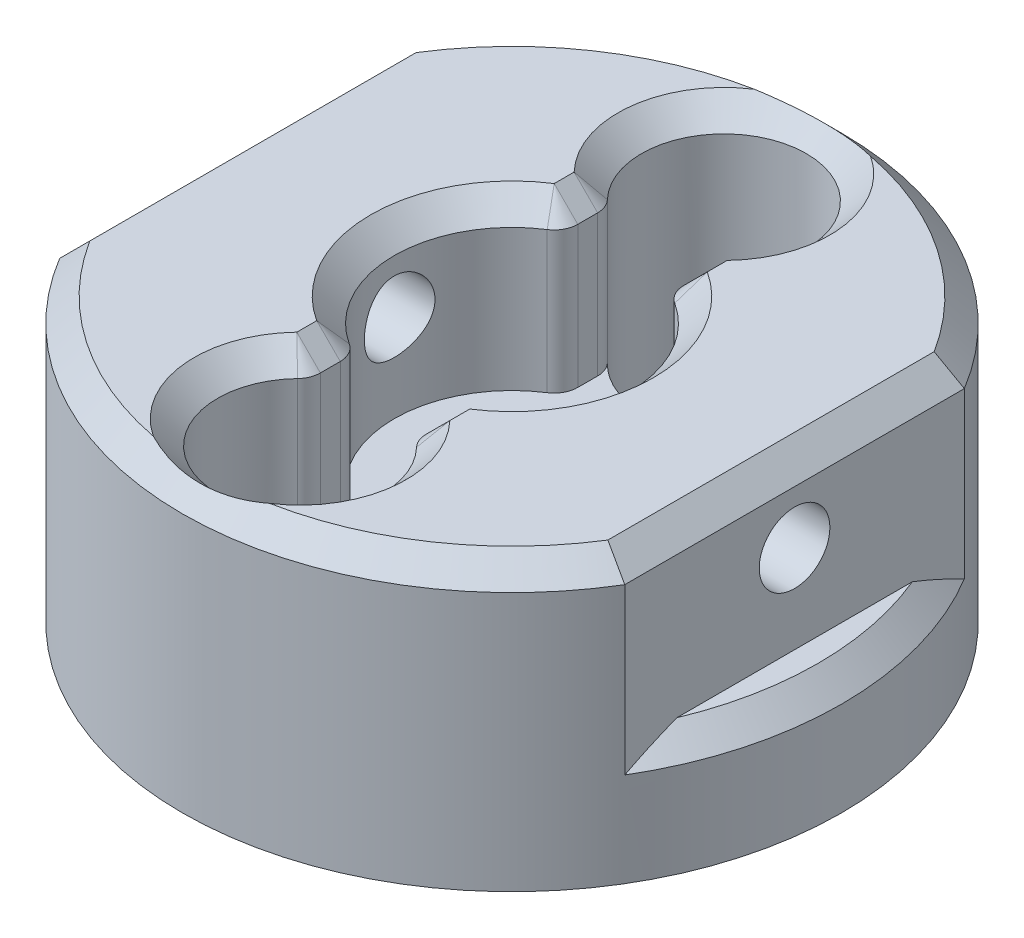
from build123d import *
from build123d.topology import SkipClean

# Parameters (mm, degrees)
SKETCH1_R           = 14
SKETCH1_R_2         = 2.25
BOSS_EXTRUDE1_DEPTH = 5
SKETCH2_R           = 1.5
CUT_EXTRUDE1_DEPTH  = 21.420577857
SKETCH4_R           = 3.5
CUT_EXTRUDE2_DEPTH  = 3
CIRPATTERN1_COUNT   = 2
SKETCH5_R           = 14
SKETCH5_R_2         = 5
BOSS_EXTRUDE2_DEPTH = 7
SKETCH6_R           = 3.5
CUT_EXTRUDE3_DEPTH  = 22
SKETCH9_OUTSIDE_W   = 38.276
SKETCH9_OUTSIDE_H   = 38.276
SKETCH9_OUTSIDE_W_2 = 24
SKETCH9_OUTSIDE_H_2 = 30
CUT_EXTRUDE5_DEPTH  = 7
SKETCH10_R          = 1.5
CUT_EXTRUDE6_DEPTH  = 32.874754901
SKETCH12_W          = 4.5
SKETCH12_H          = 18
CUT_EXTRUDE7_DEPTH  = 7
CHAMFER2_SIZE       = 0.4
CHAMFER2_SIZE2      = 4.572020921
FILLET2_R           = 1
CHAMFER3_SIZE       = 1


# Some blends are built 0.0001 mm under size
with BuildPart() as part:
    # Sketch1 → Boss-Extrude1 (new body)
    with BuildSketch(Plane(origin=(0, 0, 0), x_dir=(1, 0, 0), z_dir=(0, 1, 0))):
        with Locations(Location((0, 0, 0), (0, 0, 270))):
            Circle(SKETCH1_R)
        with Locations(Location((0, 0, 0), (0, 0, 270))):
            Circle(SKETCH1_R_2, mode=Mode.SUBTRACT)
    extrude(amount=BOSS_EXTRUDE1_DEPTH)

    # Sketch2 → Cut-Extrude1 (cut, through all)
    with BuildSketch(Plane(origin=(0, 5, 0), x_dir=(1, 0, 0), z_dir=(0, 1, 0))):
        with Locations(Location((0, 9, 0), (0, 0, 270))):
            Circle(SKETCH2_R)
    cut_extrude1 = extrude(amount=-CUT_EXTRUDE1_DEPTH, mode=Mode.SUBTRACT)

    # Sketch4 → Cut-Extrude2 (cut)
    with BuildSketch(Plane(origin=(0, 5, 0), x_dir=(1, 0, 0), z_dir=(0, 1, 0))):
        with Locations(Location((0, 9, 0), (0, 0, 270))):
            Circle(SKETCH4_R)
    cut_extrude2 = extrude(amount=-CUT_EXTRUDE2_DEPTH, mode=Mode.SUBTRACT)

    # CirPattern1: Cut-Extrude1, Cut-Extrude2 ×2 about axis
    cirpattern1_axis = Axis((0, 0, 0), (0, 1, 0))
    add([cut_extrude1.rotate(cirpattern1_axis, i * 360 / CIRPATTERN1_COUNT) for i in range(1, CIRPATTERN1_COUNT)], mode=Mode.SUBTRACT)
    add([cut_extrude2.rotate(cirpattern1_axis, i * 360 / CIRPATTERN1_COUNT) for i in range(1, CIRPATTERN1_COUNT)], mode=Mode.SUBTRACT)

    # Sketch5 → Boss-Extrude2 (add)
    with BuildSketch(Plane(origin=(0, 5, 0), x_dir=(1, 0, 0), z_dir=(0, 1, 0))):
        with Locations(Location((0, 0, 0), (0, 0, 270))):
            Circle(SKETCH5_R)
        with Locations(Location((0, 0, 0), (0, 0, 270))):
            Circle(SKETCH5_R_2, mode=Mode.SUBTRACT)
    extrude(amount=BOSS_EXTRUDE2_DEPTH)

    # Sketch6 → Cut-Extrude3 (cut, through all)
    with SkipClean():  # the faces are left unmerged after this step: merging them gives an invalid solid
        with BuildSketch(Plane(origin=(0, 5, 0), x_dir=(1, 0, 0), z_dir=(0, 1, 0))):
            with Locations(Location((0, 9, 0), (0, 0, 270))):
                Circle(SKETCH6_R)
            with Locations(Location((0, -9, 0), (0, 0, 270))):
                Circle(SKETCH6_R)
        extrude(amount=CUT_EXTRUDE3_DEPTH, mode=Mode.SUBTRACT)

    # Sketch9 outside → Cut-Extrude5 (cut)
    with SkipClean():  # the faces are left unmerged after this step: merging them gives an invalid solid
        with BuildSketch(Plane(origin=(0, 12, 0), x_dir=(1, 0, 0), z_dir=(0, 1, 0))):
            Rectangle(SKETCH9_OUTSIDE_W, SKETCH9_OUTSIDE_H)
            Rectangle(SKETCH9_OUTSIDE_W_2, SKETCH9_OUTSIDE_H_2, mode=Mode.SUBTRACT)
        extrude(amount=-CUT_EXTRUDE5_DEPTH, mode=Mode.SUBTRACT)

    # Sketch10 → Cut-Extrude6 (cut, through all)
    with SkipClean():  # the faces are left unmerged after this step: merging them gives an invalid solid
        with BuildSketch(Plane(origin=(12, 0, 0), x_dir=(0, 0, -1), z_dir=(1, 0, 0))):
            with Locations((0, 8.75)):
                Circle(SKETCH10_R)
        extrude(amount=-CUT_EXTRUDE6_DEPTH, mode=Mode.SUBTRACT)

    # Sketch12 → Cut-Extrude7 (cut)
    with SkipClean():  # the faces are left unmerged after this step: merging them gives an invalid solid
        with BuildSketch(Plane(origin=(0, 12, 0), x_dir=(1, 0, 0), z_dir=(0, 1, 0))):
            Rectangle(SKETCH12_W, SKETCH12_H)
        extrude(amount=-CUT_EXTRUDE7_DEPTH, mode=Mode.SUBTRACT)
    add(part.part.scale(1), mode=Mode.REPLACE)  # the faces are merged on a copy

    # Chamfer2
    chamfer2_edges = [part.edges().sort_by_distance(p)[0] for p in [
        (1.59099026, 5, 1.590990255),
    ]]
    chamfer2_side = [part.faces().sort_by_distance(p)[0] for p in [
        (0, 5, 3.259288519),
    ]]
    chamfer(chamfer2_edges, length=CHAMFER2_SIZE, length2=CHAMFER2_SIZE2, reference=chamfer2_side[0])

    # Fillet2
    # the kernel refuses this fillet: 1 mm, written as the material it takes off along each edge
    with BuildSketch(Plane(origin=(2.25, 13.446043689, -4.465142775), x_dir=(0, 0, -1), z_dir=(0, -1, 0)), Plane(origin=(-2.25, 13.446043689, 4.465142775), x_dir=(0, 0, 1), z_dir=(0, -1, 0))) as fillet2_piece_1:
        with BuildLine():
            CenterArc((0.578417476, 1), FILLET2_R, 212.797168296, 57.202831704)
            ThreePointArc((-0.262175899, 0.458333333), (-0.125033492, 0.232629939), (0, 0))
            Line((0, 0), (0.578417476, 0))
        make_face()
    extrude(amount=8.446043689, mode=Mode.SUBTRACT)
    with BuildSketch(Plane(origin=(2.25, 13.446043689, 4.465142775), x_dir=(0.8680218565985627, 0, -0.49652598770576395), z_dir=(0, -1, 0))) as fillet2_piece_2:
        with BuildLine():
            CenterArc((0.580822548, 0.998604999), FILLET2_R, 209.770426123, 57.202831704)
            Line((-0.287199308, 0.502079011), (0, 0))
            ThreePointArc((0, 0), (0.264010249, 0.006975006), (0.528020498, 0))
        make_face()
    extrude(amount=8.446043689, mode=Mode.SUBTRACT)
    with BuildSketch(Plane(origin=(-2.25, 13.446043689, -4.465142775), x_dir=(0, 0, -1), z_dir=(0, -1, 0))) as fillet2_piece_3:
        with BuildLine():
            CenterArc((0.578417476, -1), FILLET2_R, 90, 57.202831704)
            ThreePointArc((-0.262175899, -0.458333333), (-0.125033492, -0.232629939), (0, 0))
            Line((0, 0), (0.578417476, 0))
        make_face()
    extrude(amount=8.446043689, mode=Mode.SUBTRACT)
    with BuildSketch(Plane(origin=(-2.25, 13.07880894, -6.319048676), x_dir=(0, 0, 1), z_dir=(0, -1, 0))) as fillet2_piece_4:
        with BuildLine():
            CenterArc((0.431523576, 1), FILLET2_R, 226.238257307, 43.761742693)
            ThreePointArc((-0.260137513, 0.277777778), (-0.126290486, 0.14242722), (0, 0))
            Line((0, 0), (0.431523576, 0))
        make_face()
    extrude(amount=8.07880894, mode=Mode.SUBTRACT)
    with BuildSketch(Plane(origin=(-2.25, 13.07880894, 6.319048676), x_dir=(-0.7299030964550425, 0, 0.683550634397585), z_dir=(0, -1, 0)), Plane(origin=(2.25, 13.07880894, -6.319048676), x_dir=(0.7299030964550413, 0, -0.6835506343975865), z_dir=(0, -1, 0))) as fillet2_piece_5:
        with BuildLine():
            CenterArc((0.434934882, 0.998521029), FILLET2_R, 223.121729096, 43.761742693)
            Line((-0.294968214, 0.314970394), (0, 0))
            ThreePointArc((0, 0), (0.190284011, 0.0051764), (0.380568022, 0))
        make_face()
    extrude(amount=8.07880894, mode=Mode.SUBTRACT)
    with BuildSketch(Plane(origin=(2.25, 13.07880894, 6.319048676), x_dir=(0.7299030964550418, 0, 0.6835506343975857), z_dir=(0, -1, 0))) as fillet2_piece_6:
        with BuildLine():
            CenterArc((0.434934882, -0.998521029), FILLET2_R, 93.116528211, 43.761742693)
            Line((-0.294968214, -0.314970394), (0, 0))
            ThreePointArc((0, 0), (0.190284011, -0.0051764), (0.380568022, 0))
        make_face()
    extrude(amount=8.07880894, mode=Mode.SUBTRACT)

    # Chamfer3
    chamfer3_edges = [part.edges().sort_by_distance(p)[0] for p in [
        (-2.372028854, 12, -4.564846697),
        (5, 12, 0),
        (2.372028854, 12, -4.564846697),
        (2.25, 12, -5.465542675),
        (2.322039273, 12, -6.260203097),
        (0, 12, -12.5),
        (-2.322039273, 12, -6.260203097),
        (-2.25, 12, -5.465542675),
        (-5, 12, 0),
        (-2.372028854, 12, 4.564846697),
        (-2.25, 12, 5.465542675),
        (-2.322039273, 12, 6.260203097),
        (-3.218916614, 12, 10.374254646),
        (3.218916614, 12, 10.374254646),
        (2.322039273, 12, 6.260203097),
        (2.25, 12, 5.465542675),
        (2.372028854, 12, 4.564846697),
    ]]
    chamfer(chamfer3_edges, length=CHAMFER3_SIZE - 0.0001)  # a hair under: the kernel refuses the full size
    chamfer3_2_edges = [part.edges().sort_by_distance(p)[0] for p in [
        (-14, 5, 0),
    ]]
    chamfer(chamfer3_2_edges, length=CHAMFER3_SIZE)
    chamfer3_3_edges = [part.edges().sort_by_distance(p)[0] for p in [
        (14, 5, 0),
    ]]
    chamfer(chamfer3_3_edges, length=CHAMFER3_SIZE)
    chamfer3_4_edges = [part.edges().sort_by_distance(p)[0] for p in [
        (-12, 12, 0),
    ]]
    chamfer(chamfer3_4_edges, length=CHAMFER3_SIZE)
    chamfer3_5_edges = [part.edges().sort_by_distance(p)[0] for p in [
        (12, 12, 0),
    ]]
    chamfer(chamfer3_5_edges, length=CHAMFER3_SIZE)
    # the kernel refuses this chamfer: 1 mm, written as the material it takes off along each edge
    with BuildSketch(Plane(origin=(0, 12, 0), x_dir=(-0.8854986236945603, 0, 0.46464199921556715), z_dir=(-0.46464199921556715, 0, -0.8854986236945603))) as chamfer3_6_piece_1:
        with BuildLine():
            Line((14.028284271, -1.028284271), (12.971715729, 0.028284271))
            Line((12.971715729, 0.028284271), (12.971715729, 0.048284271))
            ThreePointArc((12.971715729, 0.048284271), (13.485857864, 0.02), (14, 0.02))
            Line((14, 0.02), (14.02, 0))
            ThreePointArc((14.02, 0), (14.02, -0.514142136), (14.048284271, -1.028284271))
            Line((14.048284271, -1.028284271), (14.028284271, -1.028284271))
        make_face()
    revolve(axis=Axis((0, 12, 0), (0, 1, 0)), revolution_arc=62.312944684, mode=Mode.SUBTRACT)
    with BuildSketch(Plane(origin=(0, 12, 0), x_dir=(0, 0, 1), z_dir=(-1, 0, 0))) as chamfer3_6_piece_2:
        with BuildLine():
            Line((14.028284271, -1.028284271), (12.971715729, 0.028284271))
            Line((12.971715729, 0.028284271), (12.971715729, 0.048284271))
            ThreePointArc((12.971715729, 0.048284271), (13.485857864, 0.02), (14, 0.02))
            Line((14, 0.02), (14.02, 0))
            ThreePointArc((14.02, 0), (14.02, -0.514142136), (14.048284271, -1.028284271))
            Line((14.048284271, -1.028284271), (14.028284271, -1.028284271))
        make_face()
    revolve(axis=Axis((0, 12, 0), (0, 1, 0)), revolution_arc=62.312944684, mode=Mode.SUBTRACT)
    # the kernel refuses this chamfer: 1 mm, written as the material it takes off along each edge
    with BuildSketch(Plane(origin=(0, 12, 0), x_dir=(0.8855326835196512, 0, -0.46457708339788484), z_dir=(0.46457708339788484, 0, 0.8855326835196512))) as chamfer3_7_piece_1:
        with BuildLine():
            Line((14.028284271, -1.028284271), (12.971715729, 0.028284271))
            Line((12.971715729, 0.028284271), (12.971715729, 0.048284271))
            ThreePointArc((12.971715729, 0.048284271), (13.485857864, 0.02), (14, 0.02))
            Line((14, 0.02), (14.02, 0))
            ThreePointArc((14.02, 0), (14.02, -0.514142136), (14.048284271, -1.028284271))
            Line((14.048284271, -1.028284271), (14.028284271, -1.028284271))
        make_face()
    revolve(axis=Axis((0, 12, 0), (0, 1, 0)), revolution_arc=124.634289903, mode=Mode.SUBTRACT)


solid = part.part
